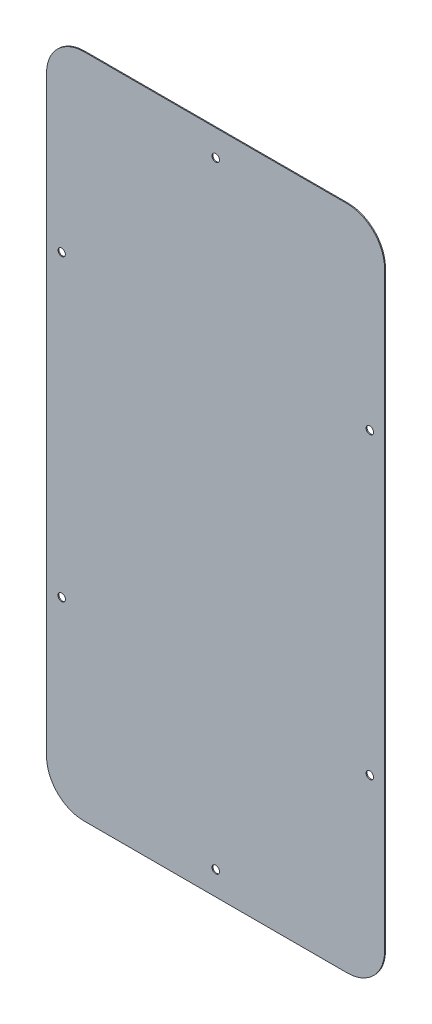
from build123d import *

# Parameters (mm, degrees)
EXTRUDE_1_DEPTH    = 0.5
SKETCH1_R          = 2
SKETCH1_R_2        = 1.950756036
CUT_EXTRUDE1_DEPTH = 379.957523828


with BuildPart() as part:
    # Эскиз1 → Вытянуть1 (new body)
    with BuildSketch(Plane.XY):
        with BuildLine():
            Line((15.068680731, 21.189389506), (156.068680731, 21.189389506))
            ThreePointArc((156.068680731, 21.189389506), (170.210816355, 15.33152513), (176.068680731, 1.189389506))
            Line((176.068680731, 1.189389506), (176.068680731, -315.571712949))
            ThreePointArc((176.068680731, -315.571712949), (170.210816355, -329.713848573), (156.068680731, -335.571712949))
            Line((156.068680731, -335.571712949), (15.068680731, -335.571712949))
            ThreePointArc((15.068680731, -335.571712949), (0.926545107, -329.713848573), (-4.931319269, -315.571712949))
            Line((-4.931319269, -315.571712949), (-4.931319269, 1.189389506))
            ThreePointArc((-4.931319269, 1.189389506), (0.926545107, 15.33152513), (15.068680731, 21.189389506))
        make_face()
    extrude(amount=EXTRUDE_1_DEPTH)

    # Sketch1 → Cut-Extrude1 (cut, through all)
    with BuildSketch(Plane.XY.offset(0.5)):
        with Locations((85.673921954, 7.189389506)):
            Circle(SKETCH1_R)
        with Locations((85.673921954, -322.810610494)):
            Circle(SKETCH1_R)
        with Locations((3.173921954, -237.810610494)):
            Circle(SKETCH1_R)
        with Locations((3.173921954, -77.810610494)):
            Circle(SKETCH1_R_2)
        with Locations((168.173921954, -77.810610494)):
            Circle(SKETCH1_R)
        with Locations((168.173921954, -237.810610494)):
            Circle(SKETCH1_R)
    extrude(amount=-CUT_EXTRUDE1_DEPTH, mode=Mode.SUBTRACT)


solid = part.part
